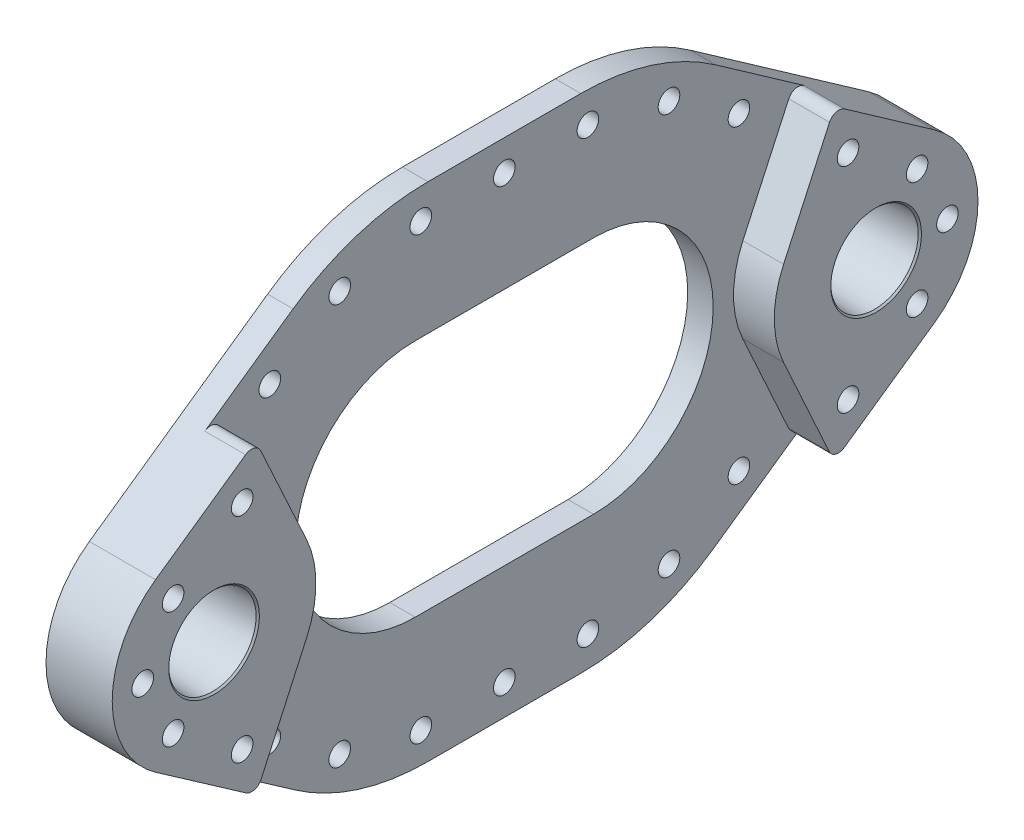
from build123d import *
from build123d.topology import SkipClean

# Parameters (mm, degrees)
BOSS_EXTRUDE1_DEPTH    = 6.35
CUT_EXTRUDE3_START     = -6.35
CUT_EXTRUDE3_OUTLINE_R = 2.69253261
CUT_EXTRUDE3_DEPTH     = 6.35
SKETCH5_W              = 104.14
SKETCH5_H              = 59.69
CUT_EXTRUDE4_DEPTH     = 6.35
FILLET1_R              = 29.845
FILLET2_R              = 29.845
SKETCH14_R             = 2.69253261
BOSS_EXTRUDE3_DEPTH    = 10.16
FILLET3_R              = 2.54
FILLET3_OF_MIRROR1_R   = 2.54


# Read off the part's stored shape, not the designer's step: Cut-Extrude3
# Some blends are built 0.0001 mm under size
with BuildPart() as part:
    # Sketch1 → Boss-Extrude1 (new body)
    with BuildSketch(Plane(origin=(0, 0, 0), x_dir=(0, 0, -1), z_dir=(1, 0, 0))):
        with BuildLine():
            Line((19.05, 62.611), (-19.05, 62.611))
            ThreePointArc((-19.05, 62.611), (-36.688219036, 59.891543079), (-52.688239169, 51.985749479))
            Line((-52.688239169, 51.985749479), (-97.140382944, 20.791361801))
            ThreePointArc((-97.140382944, 20.791361801), (-107.949982522, -0.029797308), (-97.091561196, -20.82553716))
            Line((-97.091561196, -20.82553716), (-52.170359894, -52.19204611))
            ThreePointArc((-52.170359894, -52.19204611), (-36.41024798, -59.944824567), (-19.05, -62.611))
            Line((-19.05, -62.611), (19.05, -62.611))
            ThreePointArc((19.05, -62.611), (36.41024798, -59.944824567), (52.170359894, -52.19204611))
            Line((52.170359894, -52.19204611), (97.091561196, -20.82553716))
            ThreePointArc((97.091561196, -20.82553716), (107.949982522, -0.029797308), (97.140382944, 20.791361801))
            Line((97.140382944, 20.791361801), (52.688239169, 51.985749479))
            ThreePointArc((52.688239169, 51.985749479), (36.688219036, 59.891543079), (19.05, 62.611))
        make_face()
    extrude(amount=BOSS_EXTRUDE1_DEPTH)

    # Cut-Extrude3 outline → Cut-Extrude3 (cut)
    with BuildSketch(Plane(origin=(6.35, 0, 0), x_dir=(0, 0, -1), z_dir=(1, 0, 0)).offset(CUT_EXTRUDE3_START)):
        with Locations((0, 54.991)):
            Circle(CUT_EXTRUDE3_OUTLINE_R)
        with Locations((20.828, 54.959960993)):
            Circle(CUT_EXTRUDE3_OUTLINE_R)
        with Locations((41.055062572, 49.992917233)):
            Circle(CUT_EXTRUDE3_OUTLINE_R)
        with Locations((58.492960359, 38.603215535)):
            Circle(CUT_EXTRUDE3_OUTLINE_R)
        with Locations((75.541877036, 26.639101521)):
            Circle(CUT_EXTRUDE3_OUTLINE_R)
        with Locations((92.763268061, 14.553953261)):
            Circle(CUT_EXTRUDE3_OUTLINE_R)
        with Locations((100.329987765, -0.020858116)):
            Circle(CUT_EXTRUDE3_OUTLINE_R)
        with Locations((92.763268061, -14.553953261)):
            Circle(CUT_EXTRUDE3_OUTLINE_R)
        with Locations((-20.828, 54.959960993)):
            Circle(CUT_EXTRUDE3_OUTLINE_R)
        with Locations((-41.055062572, 49.992917233)):
            Circle(CUT_EXTRUDE3_OUTLINE_R)
        with Locations((-58.492960359, 38.603215535)):
            Circle(CUT_EXTRUDE3_OUTLINE_R)
        with Locations((-75.541877036, 26.639101521)):
            Circle(CUT_EXTRUDE3_OUTLINE_R)
        with Locations((-92.763268061, 14.553953261)):
            Circle(CUT_EXTRUDE3_OUTLINE_R)
        with Locations((-100.329987765, -0.020858116)):
            Circle(CUT_EXTRUDE3_OUTLINE_R)
        with Locations((-92.763268061, -14.553953261)):
            Circle(CUT_EXTRUDE3_OUTLINE_R)
        with Locations((-75.541877036, -26.639101521)):
            Circle(CUT_EXTRUDE3_OUTLINE_R)
        with Locations((-58.492960359, -38.603215535)):
            Circle(CUT_EXTRUDE3_OUTLINE_R)
        with Locations((-41.055062572, -49.992917233)):
            Circle(CUT_EXTRUDE3_OUTLINE_R)
        with Locations((-20.828, -54.959960993)):
            Circle(CUT_EXTRUDE3_OUTLINE_R)
        with Locations((0, -54.991)):
            Circle(CUT_EXTRUDE3_OUTLINE_R)
        with Locations((20.828, -54.959960993)):
            Circle(CUT_EXTRUDE3_OUTLINE_R)
        with Locations((41.055062572, -49.992917233)):
            Circle(CUT_EXTRUDE3_OUTLINE_R)
        with Locations((58.492960359, -38.603215535)):
            Circle(CUT_EXTRUDE3_OUTLINE_R)
        with Locations((75.541877036, -26.639101521)):
            Circle(CUT_EXTRUDE3_OUTLINE_R)
    extrude(amount=CUT_EXTRUDE3_DEPTH, mode=Mode.SUBTRACT)

    # Sketch5 → Cut-Extrude4 (cut)
    with BuildSketch(Plane(origin=(6.35, 0, 0), x_dir=(0, 0, -1), z_dir=(1, 0, 0))):
        Rectangle(SKETCH5_W, SKETCH5_H)
    extrude(amount=-CUT_EXTRUDE4_DEPTH, mode=Mode.SUBTRACT)

    # Fillet1
    fillet1_edges = [part.edges().sort_by_distance(p)[0] for p in [
        (3.175, -29.845, 52.07),
        (3.175, 29.845, 52.07),
    ]]
    fillet(fillet1_edges, radius=FILLET1_R - 0.0001)  # a hair under: the kernel refuses the full size

    # Fillet2
    fillet2_edges = [part.edges().sort_by_distance(p)[0] for p in [
        (3.175, 29.845, -52.07),
        (3.175, -29.845, -52.07),
    ]]
    fillet(fillet2_edges, radius=FILLET2_R - 0.0001)  # a hair under: the kernel refuses the full size

    # Sketch14 → Boss-Extrude3 (add)
    # profile 1 of 3: a face of its own
    with SkipClean():  # the faces are left unmerged after this step: merging them gives an invalid solid
        with BuildSketch(Plane(origin=(6.35, 0, 0), x_dir=(0, 0, -1), z_dir=(1, 0, 0))):
            with BuildLine():
                ThreePointArc((77.610004669, -24.914984369), (87.76808503, -24.858229797), (97.091561196, -20.82553716))
                ThreePointArc((97.091561196, -20.82553716), (105.072385024, -11.743175585), (107.95, 0))
                ThreePointArc((107.95, 0), (105.086145708, 11.716745991), (97.140382944, 20.791361801))
                ThreePointArc((97.140382944, 20.791361801), (87.797243185, 24.852091239), (77.610004669, 24.914984369))
                ThreePointArc((77.610004669, 24.914984369), (76.226910447, 24.03516967), (74.589917057, 24.120470135))
                ThreePointArc((74.589917057, 24.120470135), (65.621214015, 18.936108499), (59.468427534, 10.601934374))
                ThreePointArc((59.468427534, 10.601934374), (57.150017478, 0.029797308), (59.443616349, -10.547750213))
                ThreePointArc((59.443616349, -10.547750213), (65.599011292, -18.916235931), (74.589917057, -24.120470135))
                ThreePointArc((74.589917057, -24.120470135), (76.226910447, -24.03516967), (77.610004669, -24.914984369))
            make_face()
            with Locations((92.763268061, -14.553953261)):
                Circle(SKETCH14_R, mode=Mode.SUBTRACT)
            with Locations((100.329987765, -0.020858116)):
                Circle(SKETCH14_R, mode=Mode.SUBTRACT)
            with Locations((92.763268061, 14.553953261)):
                Circle(SKETCH14_R, mode=Mode.SUBTRACT)
        # profile 2 of 3: a face of its own
        with BuildSketch(Plane(origin=(6.35, 0, 0), x_dir=(0, 0, -1), z_dir=(1, 0, 0))):
            with BuildLine():
                ThreePointArc((77.610004669, 24.914984369), (87.797243185, 24.852091239), (97.140382944, 20.791361801))
                Line((97.140382944, 20.791361801), (72.190748783, 38.299821334))
                Line((72.190748783, 38.299821334), (59.468427534, 10.601934374))
                ThreePointArc((59.468427534, 10.601934374), (65.621214015, 18.936108499), (74.589917057, 24.120470135))
                ThreePointArc((74.589917057, 24.120470135), (74.011101322, 28.854154019), (78.234409646, 26.639101521))
                ThreePointArc((78.234409646, 26.639101521), (78.073500324, 25.722250725), (77.610004669, 24.914984369))
            make_face()
        # profile 3 of 3: a face of its own
        with BuildSketch(Plane(origin=(6.35, 0, 0), x_dir=(0, 0, -1), z_dir=(1, 0, 0))):
            with BuildLine():
                Line((72.100916604, -38.275410595), (97.091561196, -20.82553716))
                ThreePointArc((97.091561196, -20.82553716), (87.76808503, -24.858229797), (77.610004669, -24.914984369))
                ThreePointArc((77.610004669, -24.914984369), (78.073500324, -25.722250725), (78.234409646, -26.639101521))
                ThreePointArc((78.234409646, -26.639101521), (74.011101322, -28.854154019), (74.589917057, -24.120470135))
                ThreePointArc((74.589917057, -24.120470135), (65.599011292, -18.916235931), (59.443616349, -10.547750213))
                Line((59.443616349, -10.547750213), (72.100916604, -38.275410595))
            make_face()
        boss_extrude3 = extrude(amount=BOSS_EXTRUDE3_DEPTH)

    # Fillet3
    # the kernel refuses this fillet: 2.54 mm, written as the material it takes off along each edge
    with BuildSketch(Plane(origin=(6.35, -38.275410595, -72.100916604), x_dir=(0, 0.5725024092761827, -0.8199030377873753), z_dir=(1, 0, 0))) as fillet3_piece_1:
        with BuildLine():
            CenterArc((FILLET3_R * 1.2, FILLET3_R), FILLET3_R, 169.611142185, 100.388857815)
            Line((FILLET3_R * 0.216393442623, FILLET3_R * 1.18032786885), (0, 0))
            Line((0, 0), (FILLET3_R * 1.2, 0))
        make_face()
    extrude(amount=17.78, mode=Mode.SUBTRACT)
    with BuildSketch(Plane(origin=(6.35, 38.299821334, -72.190748783), x_dir=(0, -0.5744245253621356, -0.8185575512219561), z_dir=(1, 0, 0))) as fillet3_piece_2:
        with BuildLine():
            CenterArc((FILLET3_R * 1.2, -FILLET3_R), FILLET3_R, 90, 100.388857815)
            Line((FILLET3_R * 0.216393442623, -FILLET3_R * 1.18032786885), (0, 0))
            Line((0, 0), (FILLET3_R * 1.2, 0))
        make_face()
    extrude(amount=17.78, mode=Mode.SUBTRACT)

    # Sketch16 → 1/2 NPT Tapped Hole4 (revolve, cut)
    with SkipClean():  # the faces are left unmerged after this step: merging them gives an invalid solid
        with BuildSketch(Plane(origin=(16.51, 0, -82.55), x_dir=(0, 0, -1), z_dir=(0, 1, 0))):
            Polygon((0, 0), (0, 16.511), (8.9281, 16.511), (8.9281, 21.082), (10.273935163, 21.082), (10.8928789, 0.4101211), (11.303, 0), align=None)
        f_1_2_npt_tapped_hole4 = revolve(axis=Axis((22.86, 0, -82.55), (-1, 0, 0)), mode=Mode.SUBTRACT)

    # Mirror1: Boss-Extrude3, 1/2 NPT Tapped Hole4 across plane
    with SkipClean():  # the faces are left unmerged after this step: merging them gives an invalid solid
        add(boss_extrude3.mirror(Plane.XY))
        add(f_1_2_npt_tapped_hole4.mirror(Plane.XY), mode=Mode.SUBTRACT)

    # Fillet3 of Mirror1
    # the kernel refuses this fillet: 2.54 mm, written as the material it takes off along each edge
    with BuildSketch(Plane(origin=(6.35, -38.275410595, 72.100916604), x_dir=(0, 0.5725024092761827, 0.8199030377873753), z_dir=(1, 0, 0))) as fillet3_of_mirror1_piece_1:
        with BuildLine():
            CenterArc((FILLET3_OF_MIRROR1_R * 1.2, -FILLET3_OF_MIRROR1_R), FILLET3_OF_MIRROR1_R, 90, 100.388857815)
            Line((FILLET3_OF_MIRROR1_R * 0.216393442623, -FILLET3_OF_MIRROR1_R * 1.18032786885), (0, 0))
            Line((0, 0), (FILLET3_OF_MIRROR1_R * 1.2, 0))
        make_face()
    extrude(amount=17.78, mode=Mode.SUBTRACT)
    with BuildSketch(Plane(origin=(6.35, 38.299821334, 72.190748783), x_dir=(0, -0.5744245253621356, 0.8185575512219561), z_dir=(1, 0, 0))) as fillet3_of_mirror1_piece_2:
        with BuildLine():
            CenterArc((FILLET3_OF_MIRROR1_R * 1.2, FILLET3_OF_MIRROR1_R), FILLET3_OF_MIRROR1_R, 169.611142185, 100.388857815)
            Line((FILLET3_OF_MIRROR1_R * 0.216393442623, FILLET3_OF_MIRROR1_R * 1.18032786885), (0, 0))
            Line((0, 0), (FILLET3_OF_MIRROR1_R * 1.2, 0))
        make_face()
    extrude(amount=17.78, mode=Mode.SUBTRACT)


solid = part.part
